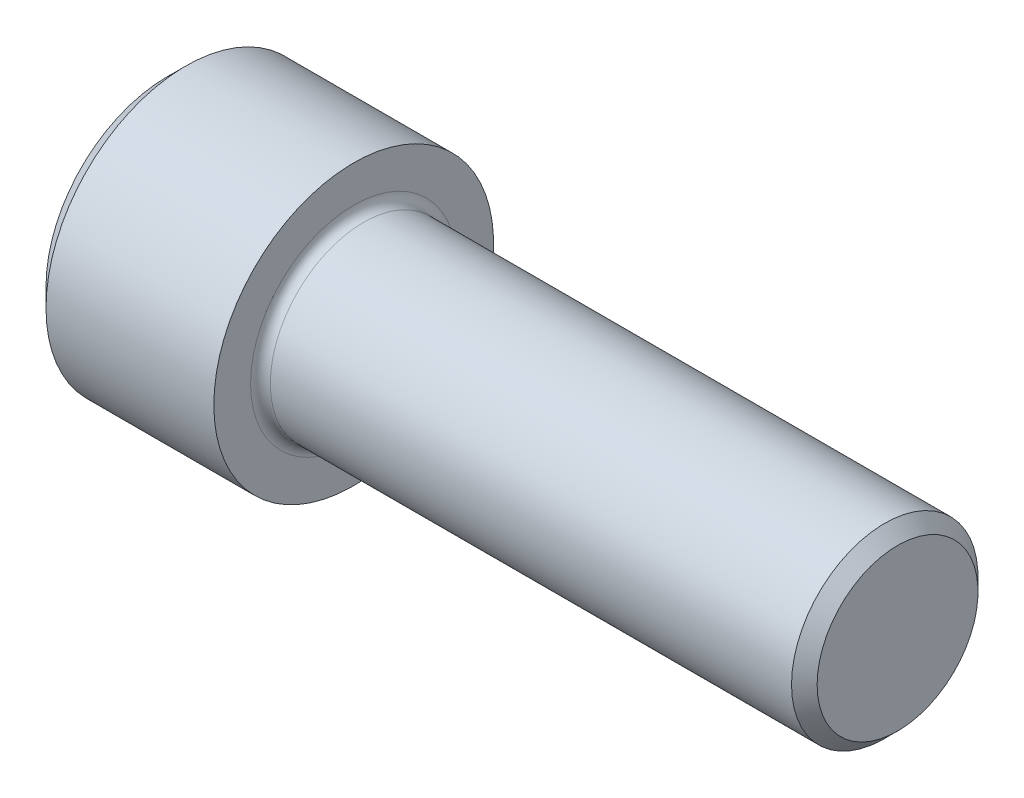
from build123d import *

# Parameters (mm, degrees)
FILLET1_R   = 1.27
HEX_2_DEPTH = 12


with BuildPart() as part:
    # BodySke → Base-Revolve (revolve)
    with BuildSketch(Plane.XY):
        Polygon((0, 0), (0, 15.6), (2.4, 18), (24, 18), (24, 12), (92.352, 12), (94, 10.352), (94, 0), align=None)
    revolve(axis=Axis((-31.75, 0, 0), (1, 0, 0)))

    # Fillet1
    fillet1_edges = [part.edges().sort_by_distance(p)[0] for p in [
        (24, -12, 0),
    ]]
    fillet(fillet1_edges, radius=FILLET1_R)

    # Sketch2 → Hex-PreBroach (revolve, cut)
    with BuildSketch(Plane.XY):
        Polygon((0, 9.5), (12, 9.5), (17.484827557, 0), (0, 0), align=None)
    revolve(axis=Axis((0, 0, 0), (1, 0, 0)), mode=Mode.SUBTRACT)

    # Sketch3 → Hex 2 (cut)
    with BuildSketch(Plane(origin=(0, 0, 0), x_dir=(0, 0.500000000000001, 0.866025403784438), z_dir=(-1, 0, 0))):
        Polygon((5.484827557, 9.5), (-5.484827557, 9.5), (-10.969655115, 0), (-5.484827557, -9.5), (5.484827557, -9.5), (10.969655115, 0), align=None)
    extrude(amount=-HEX_2_DEPTH, mode=Mode.SUBTRACT)


solid = part.part
